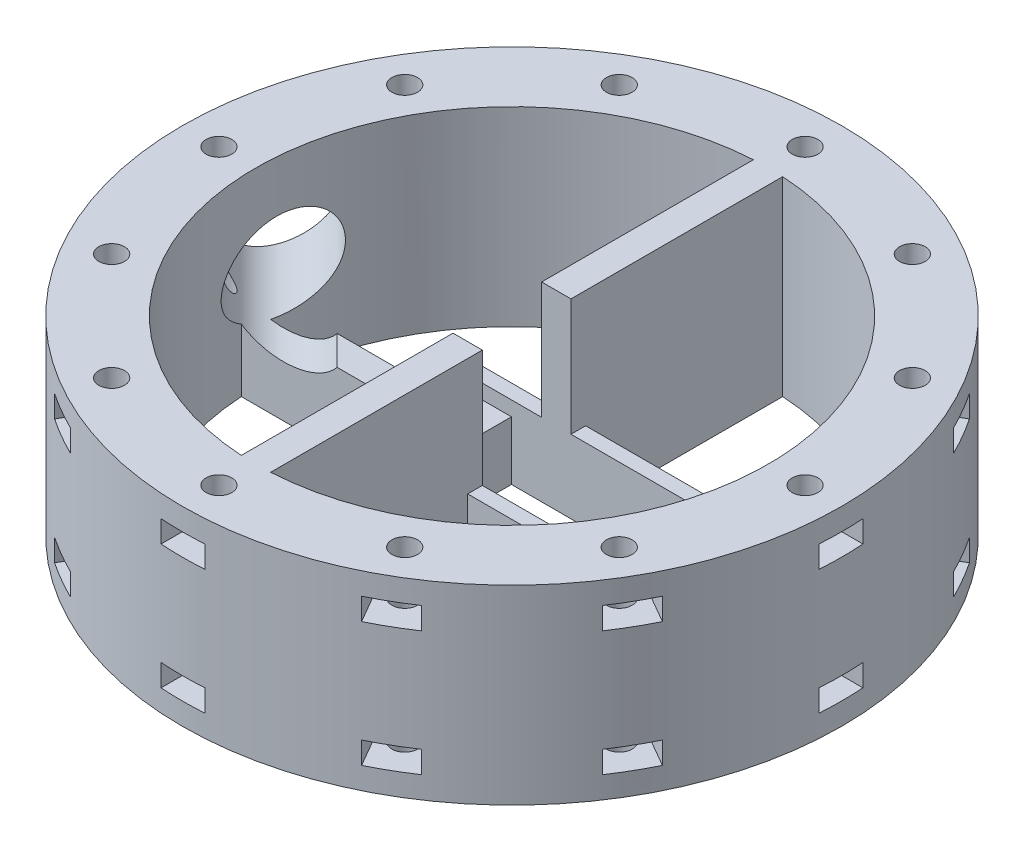
from build123d import *
from build123d.topology import SkipClean

# Parameters (mm, degrees)
SKETCH2_R           = 45
BOSS_EXTRUDE1_DEPTH = 10
SKETCH3_W           = 32.25
SKETCH3_H           = 12.1
CUT_EXTRUDE1_DEPTH  = 2
SKETCH4_W           = 22.6
SKETCH4_H           = 12.1
CUT_EXTRUDE2_DEPTH  = 65.140470843
SKETCH6_R           = 1
CUT_EXTRUDE4_DEPTH  = 65.140470843
CUT_EXTRUDE5_DEPTH  = 65.420493634
BOSS_EXTRUDE2_START = 16
SKETCH13_R          = 45
BOSS_EXTRUDE2_DEPTH = 16
SKETCH10_R          = 1.75
CUT_EXTRUDE7_DEPTH  = 69.745908969
CUT_EXTRUDE8_DEPTH  = 3
SKETCH15_R          = 6
CUT_EXTRUDE9_DEPTH  = 69.745908969


with BuildPart() as part:
    # Sketch2 → Boss-Extrude1 (new body)
    with BuildSketch(Plane(origin=(0, 0, 0), x_dir=(1, 0, 0), z_dir=(0, 1, 0))):
        Circle(SKETCH2_R)
    extrude(amount=BOSS_EXTRUDE1_DEPTH)

    # Sketch3 → Cut-Extrude1 (cut)
    with BuildSketch(Plane(origin=(0, 10, 0), x_dir=(1, 0, 0), z_dir=(0, 1, 0))):
        with Locations((5.175, 0)):
            Rectangle(SKETCH3_W, SKETCH3_H)
    extrude(amount=-CUT_EXTRUDE1_DEPTH, mode=Mode.SUBTRACT)

    # Sketch4 → Cut-Extrude2 (cut, through all)
    with BuildSketch(Plane(origin=(0, 8, 0), x_dir=(1, 0, 0), z_dir=(0, 1, 0))):
        with Locations((5.175, 0)):
            Rectangle(SKETCH4_W, SKETCH4_H)
    extrude(amount=-CUT_EXTRUDE2_DEPTH, mode=Mode.SUBTRACT)

    # Sketch6 → Cut-Extrude4 (cut, through all)
    with BuildSketch(Plane(origin=(0, 8, 0), x_dir=(1, 0, 0), z_dir=(0, 1, 0))):
        with Locations((-8.675, 0)):
            Circle(SKETCH6_R)
        with Locations((19.025, 0)):
            Circle(SKETCH6_R)
    extrude(amount=-CUT_EXTRUDE4_DEPTH, mode=Mode.SUBTRACT)

    # Sketch9 → Cut-Extrude5 (cut, through all)
    with BuildSketch(Plane(origin=(0, 10, 0), x_dir=(1, 0, 0), z_dir=(0, 1, 0))):
        with BuildLine():
            Line((-12.95, 8.05), (-2, 8.05))
            Line((-2, 8.05), (-2, 34.942810419))
            ThreePointArc((-2, 34.942810419), (-24.748737342, 24.748737342), (-34.942810419, 2))
            Line((-34.942810419, 2), (-12.95, 2))
            Line((-12.95, 2), (-12.95, 8.05))
        make_face()
        with BuildLine():
            Line((-12.95, -8.05), (-2, -8.05))
            Line((-2, -8.05), (-2, -34.942810419))
            ThreePointArc((-2, -34.942810419), (-24.748737342, -24.748737342), (-34.942810419, -2))
            Line((-34.942810419, -2), (-12.95, -2))
            Line((-12.95, -2), (-12.95, -8.05))
        make_face()
        with BuildLine():
            Line((2, 34.942810419), (2, 8.05))
            Line((2, 8.05), (34.061672008, 8.05))
            ThreePointArc((34.061672008, 8.05), (22.492595672, 26.815725609), (2, 34.942810419))
        make_face()
        with BuildLine():
            Line((2, -34.942810419), (2, -8.05))
            Line((2, -8.05), (34.061672008, -8.05))
            ThreePointArc((34.061672008, -8.05), (22.492595672, -26.815725609), (2, -34.942810419))
        make_face()
    extrude(amount=-CUT_EXTRUDE5_DEPTH, mode=Mode.SUBTRACT)

    # Sketch13 → Boss-Extrude2 (add)
    with SkipClean():  # the faces are left unmerged after this step: merging them gives an invalid solid
        with BuildSketch(Plane(origin=(0, 10, 0), x_dir=(1, 0, 0), z_dir=(0, 1, 0)).offset(BOSS_EXTRUDE2_START)):
            Circle(SKETCH13_R)
            with BuildLine():
                Line((2, -34.942810419), (2, -8.05))
                Line((2, -8.05), (2, -6.05))
                Line((2, -6.05), (-2, -6.05))
                Line((-2, -6.05), (-2, -8.05))
                Line((-2, -8.05), (-2, -34.942810419))
                ThreePointArc((-2, -34.942810419), (-26.122511764, -23.294084639), (-34.942810419, 2))
                ThreePointArc((-34.942810419, 2), (-24.748737342, 24.748737342), (-2, 34.942810419))
                Line((-2, 34.942810419), (-2, 6.05))
                Line((-2, 6.05), (2, 6.05))
                Line((2, 6.05), (2, 34.942810419))
                ThreePointArc((2, 34.942810419), (25.10008578, 24.392328586), (34.985711369, 1))
                ThreePointArc((34.985711369, 1), (25.786762429, -23.665225193), (2, -34.942810419))
            make_face(mode=Mode.SUBTRACT)
        extrude(amount=-BOSS_EXTRUDE2_DEPTH)

    # Sketch10 → Cut-Extrude7 (cut, through all)
    with SkipClean():  # the faces are left unmerged after this step: merging them gives an invalid solid
        with BuildSketch(Plane.XZ):
            with Locations((-40, 0)):
                Circle(SKETCH10_R)
            with Locations((-34.641016151, 20)):
                Circle(SKETCH10_R)
            with Locations((-20, 34.641016151)):
                Circle(SKETCH10_R)
            with Locations((0, 40)):
                Circle(SKETCH10_R)
            with Locations((20, 34.641016151)):
                Circle(SKETCH10_R)
            with Locations((34.641016151, 20)):
                Circle(SKETCH10_R)
            with Locations((40, 0)):
                Circle(SKETCH10_R)
            with Locations((34.641016151, -20)):
                Circle(SKETCH10_R)
            with Locations((20, -34.641016151)):
                Circle(SKETCH10_R)
            with Locations((0, -40)):
                Circle(SKETCH10_R)
            with Locations((-20, -34.641016151)):
                Circle(SKETCH10_R)
            with Locations((-34.641016151, -20)):
                Circle(SKETCH10_R)
        extrude(amount=-CUT_EXTRUDE7_DEPTH, mode=Mode.SUBTRACT)

    # Sketch14 → Cut-Extrude8 (cut)
    with BuildSketch(Plane(origin=(0, 23, 0), x_dir=(1, 0, 0), z_dir=(0, 1, 0))):
        with BuildLine():
            Line((31.641016151, -18.267949192), (31.641016151, -21.732050808))
            Line((31.641016151, -21.732050808), (37.38444419, -25.048020532))
            ThreePointArc((37.38444419, -25.048020532), (38.97114317, -22.5), (40.38444419, -19.851868109))
            Line((40.38444419, -19.851868109), (34.641016151, -16.535898385))
            Line((34.641016151, -16.535898385), (31.641016151, -18.267949192))
        make_face()
        with BuildLine():
            Line((36.535898385, 0), (38.267949192, -3))
            Line((38.267949192, -3), (44.899888641, -3))
            ThreePointArc((44.899888641, -3), (45, 0), (44.899888641, 3))
            Line((44.899888641, 3), (38.267949192, 3))
            Line((38.267949192, 3), (36.535898385, 0))
        make_face()
        with BuildLine():
            Line((18.267949192, -31.641016151), (16.535898385, -34.641016151))
            Line((16.535898385, -34.641016151), (19.851868109, -40.38444419))
            ThreePointArc((19.851868109, -40.38444419), (22.5, -38.97114317), (25.048020532, -37.38444419))
            Line((25.048020532, -37.38444419), (21.732050808, -31.641016151))
            Line((21.732050808, -31.641016151), (18.267949192, -31.641016151))
        make_face()
        with BuildLine():
            Line((0, -36.535898385), (-3, -38.267949192))
            Line((-3, -38.267949192), (-3, -44.899888641))
            ThreePointArc((-3, -44.899888641), (0, -45), (3, -44.899888641))
            Line((3, -44.899888641), (3, -38.267949192))
            Line((3, -38.267949192), (0, -36.535898385))
        make_face()
        with BuildLine():
            Line((-18.267949192, -31.641016151), (-21.732050808, -31.641016151))
            Line((-21.732050808, -31.641016151), (-25.048020532, -37.38444419))
            ThreePointArc((-25.048020532, -37.38444419), (-22.5, -38.97114317), (-19.851868109, -40.38444419))
            Line((-19.851868109, -40.38444419), (-16.535898385, -34.641016151))
            Line((-16.535898385, -34.641016151), (-18.267949192, -31.641016151))
        make_face()
        with BuildLine():
            Line((-31.641016151, -18.267949192), (-34.641016151, -16.535898385))
            Line((-34.641016151, -16.535898385), (-40.38444419, -19.851868109))
            ThreePointArc((-40.38444419, -19.851868109), (-38.97114317, -22.5), (-37.38444419, -25.048020532))
            Line((-37.38444419, -25.048020532), (-31.641016151, -21.732050808))
            Line((-31.641016151, -21.732050808), (-31.641016151, -18.267949192))
        make_face()
        with BuildLine():
            Line((-36.535898385, 0), (-38.267949192, 3))
            Line((-38.267949192, 3), (-44.899888641, 3))
            ThreePointArc((-44.899888641, 3), (-45, 0), (-44.899888641, -3))
            Line((-44.899888641, -3), (-38.267949192, -3))
            Line((-38.267949192, -3), (-36.535898385, 0))
        make_face()
        with BuildLine():
            Line((-31.641016151, 18.267949192), (-31.641016151, 21.732050808))
            Line((-31.641016151, 21.732050808), (-37.38444419, 25.048020532))
            ThreePointArc((-37.38444419, 25.048020532), (-38.97114317, 22.5), (-40.38444419, 19.851868109))
            Line((-40.38444419, 19.851868109), (-34.641016151, 16.535898385))
            Line((-34.641016151, 16.535898385), (-31.641016151, 18.267949192))
        make_face()
        with BuildLine():
            Line((-18.267949192, 31.641016151), (-16.535898385, 34.641016151))
            Line((-16.535898385, 34.641016151), (-19.851868109, 40.38444419))
            ThreePointArc((-19.851868109, 40.38444419), (-22.5, 38.97114317), (-25.048020532, 37.38444419))
            Line((-25.048020532, 37.38444419), (-21.732050808, 31.641016151))
            Line((-21.732050808, 31.641016151), (-18.267949192, 31.641016151))
        make_face()
        with BuildLine():
            Line((0, 36.535898385), (3, 38.267949192))
            Line((3, 38.267949192), (3, 44.899888641))
            ThreePointArc((3, 44.899888641), (0, 45), (-3, 44.899888641))
            Line((-3, 44.899888641), (-3, 38.267949192))
            Line((-3, 38.267949192), (0, 36.535898385))
        make_face()
        with BuildLine():
            Line((18.267949192, 31.641016151), (21.732050808, 31.641016151))
            Line((21.732050808, 31.641016151), (25.048020532, 37.38444419))
            ThreePointArc((25.048020532, 37.38444419), (22.5, 38.97114317), (19.851868109, 40.38444419))
            Line((19.851868109, 40.38444419), (16.535898385, 34.641016151))
            Line((16.535898385, 34.641016151), (18.267949192, 31.641016151))
        make_face()
        with BuildLine():
            Line((31.641016151, 18.267949192), (34.641016151, 16.535898385))
            Line((34.641016151, 16.535898385), (40.38444419, 19.851868109))
            ThreePointArc((40.38444419, 19.851868109), (38.97114317, 22.5), (37.38444419, 25.048020532))
            Line((37.38444419, 25.048020532), (31.641016151, 21.732050808))
            Line((31.641016151, 21.732050808), (31.641016151, 18.267949192))
        make_face()
    cut_extrude8 = extrude(amount=-CUT_EXTRUDE8_DEPTH, mode=Mode.SUBTRACT)

    # Mirror1: Cut-Extrude8 across plane
    add(cut_extrude8.mirror(Plane.ZX.offset(13)), mode=Mode.SUBTRACT)

    # Sketch15 → Cut-Extrude9 (cut, through all)
    with BuildSketch(Plane(origin=(0, 0, 0), x_dir=(-0.7071067811865477, 0, 0.7071067811865474), z_dir=(-0.7071067811865474, 0, -0.7071067811865477))):
        with Locations((22.073209586, 13)):
            Circle(SKETCH15_R)
    extrude(amount=CUT_EXTRUDE9_DEPTH, mode=Mode.SUBTRACT)


solid = part.part
